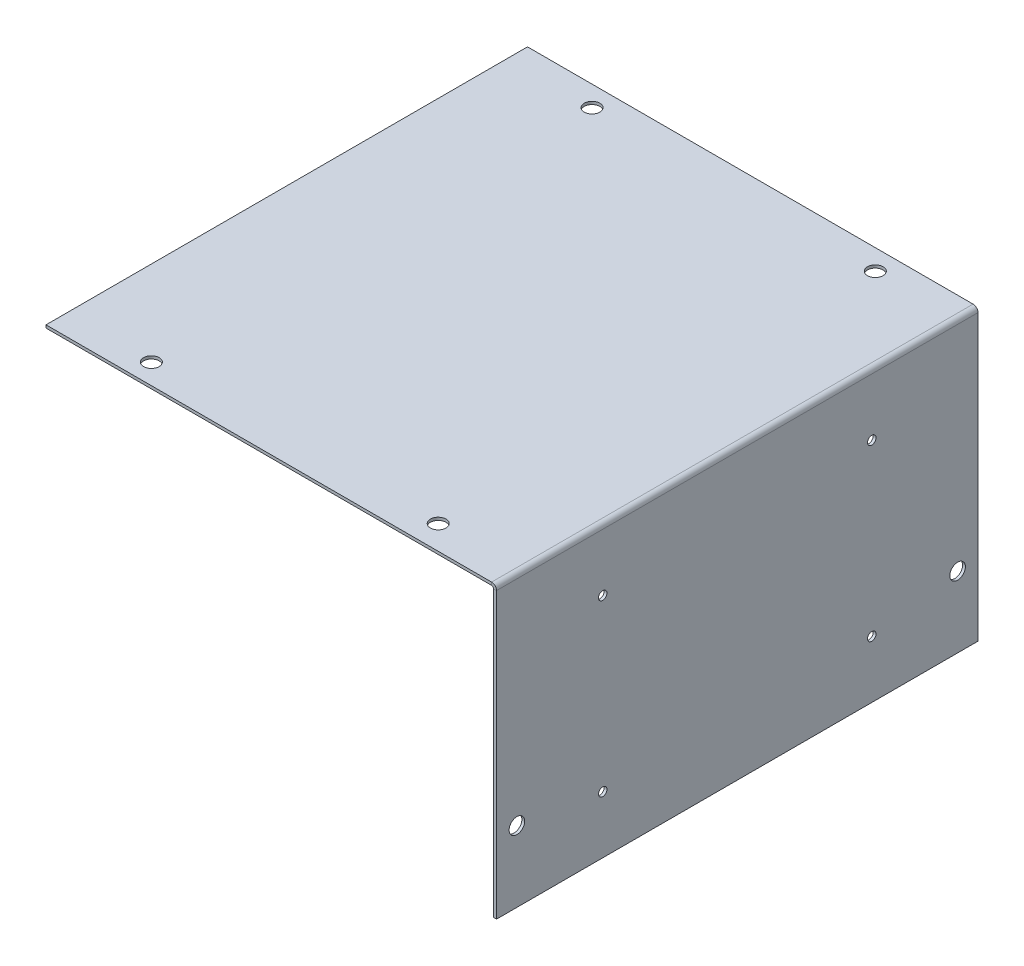
from build123d import *

# Parameters (mm, degrees)
SM_BASE_FLANGE_1_DEPTH = 170
SKETCH_6_R             = 2.75
CUT_EXTRUDE_1_DEPTH    = 10
SKETCH_8_R             = 2.75
CUT_EXTRUDE_2_DEPTH    = 10
HOLE_WIZARD_3_0_3_1_D  = 3


# Sheet-metal steps are written as plain solids
with BuildPart() as part:
    # Sketch 1 → 基体-法兰1 (new body)
    with BuildSketch(Plane.XY):
        with BuildLine():
            Line((-155.610979595, 26.743544458), (1.715820405, 26.743544458))
            ThreePointArc((1.715820405, 26.743544458), (2.23667526, 26.527799313), (2.452420405, 26.006944458))
            Line((2.452420405, 26.006944458), (2.452420405, -74.456455542))
            Line((2.452420405, -74.456455542), (3.452420405, -74.456455542))
            Line((3.452420405, -74.456455542), (3.452420405, 26.006944458))
            ThreePointArc((3.452420405, 26.006944458), (2.943782042, 27.234906094), (1.715820405, 27.743544458))
            Line((1.715820405, 27.743544458), (-155.610979595, 27.743544458))
            Line((-155.610979595, 27.743544458), (-155.610979595, 26.743544458))
        make_face()
    extrude(amount=SM_BASE_FLANGE_1_DEPTH)

    # 草图6 → 切除-拉伸1 (cut)
    with BuildSketch(Plane(origin=(0, 27.743544458, 0), x_dir=(-1, 0, 0), z_dir=(0, 1, 0))):
        with Locations((125.610979595, 162.8)):
            Circle(SKETCH_6_R)
        with Locations((25.610979595, 161.523456844)):
            Circle(SKETCH_6_R)
        with Locations((25.610979595, 7.2)):
            Circle(SKETCH_6_R)
        with Locations((125.610979595, 7.2)):
            Circle(SKETCH_6_R)
    extrude(amount=-CUT_EXTRUDE_1_DEPTH, mode=Mode.SUBTRACT)

    # 草图8 → 切除-拉伸2 (cut)
    with BuildSketch(Plane(origin=(3.452420405, 0, 0), x_dir=(0, 0, -1), z_dir=(1, 0, 0))):
        with Locations(Location((-162.8, -49.456455542, 0), (0, 0, 90))):
            Circle(SKETCH_8_R)
        with Locations(Location((-7.2, -49.456455542, 0), (0, 0, 90))):
            Circle(SKETCH_8_R)
    extrude(amount=-CUT_EXTRUDE_2_DEPTH, mode=Mode.SUBTRACT)

    # Ø3.0 (3) 直径孔1 (through all)
    with Locations(Plane(origin=(3.452420405, 0, 0), x_dir=(0, 0, -1), z_dir=(1, 0, 0))):
        with Locations((-132.5, 5.757044458), (-37.5, 5.757044458), (-37.5, -54.242955542), (-132.5, -54.242955542)):
            Hole(HOLE_WIZARD_3_0_3_1_D / 2)


solid = part.part
